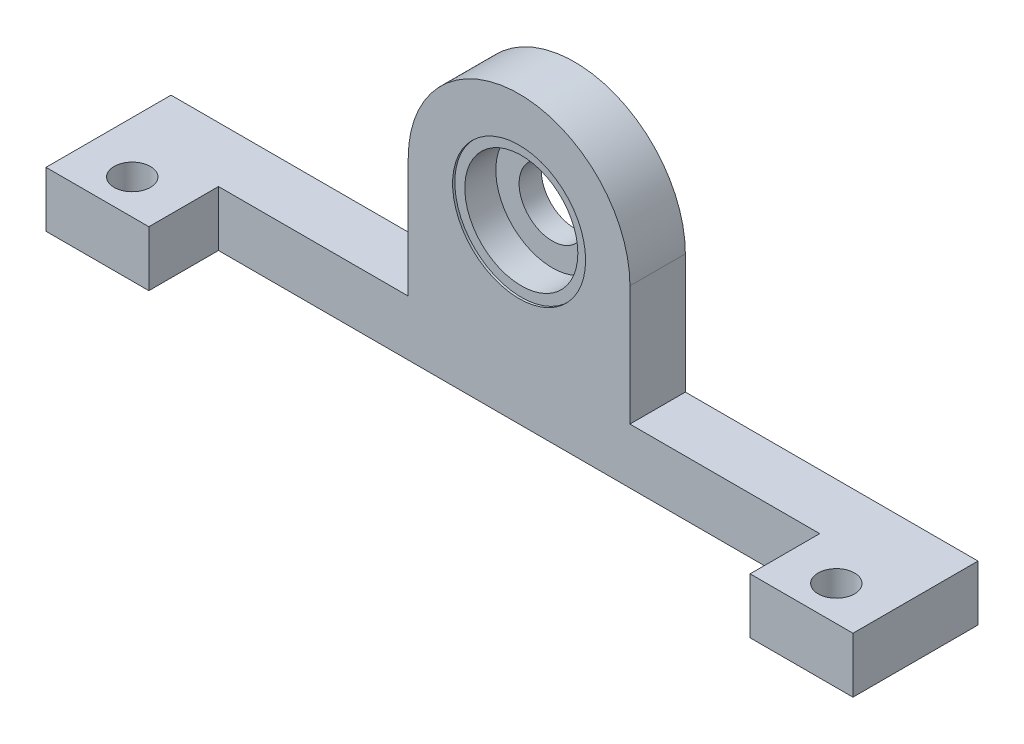
from build123d import *

# Parameters (mm, degrees)
SKETCH1_R           = 3.81
BOSS_EXTRUDE1_DEPTH = 3.175
SKETCH2_R           = 6.477
CUT_EXTRUDE1_DEPTH  = 3.81
SKETCH3_R           = 7.62
CUT_EXTRUDE2_DEPTH  = 0.254
SKETCH6_W           = 11.7856
SKETCH6_H           = 6.35
BOSS_EXTRUDE2_DEPTH = 7.9756
SKETCH7_R           = 2.0828
CUT_EXTRUDE4_DEPTH  = 55.398243725


with BuildPart() as part:
    # Sketch1 → Boss-Extrude1 (new, symmetric)
    with BuildSketch(Plane.XY):
        with BuildLine():
            Line((-12.7, 0), (-12.7, -13.716))
            Line((-12.7, -13.716), (-46.228, -13.716))
            Line((-46.228, -13.716), (-46.228, -20.066))
            Line((-46.228, -20.066), (46.228, -20.066))
            Line((46.228, -20.066), (46.228, -13.716))
            Line((46.228, -13.716), (12.7, -13.716))
            Line((12.7, -13.716), (12.7, 0))
            ThreePointArc((12.7, 0), (0, 12.7), (-12.7, 0))
        make_face()
        Circle(SKETCH1_R, mode=Mode.SUBTRACT)
    extrude(amount=BOSS_EXTRUDE1_DEPTH, both=True)

    # Sketch2 → Cut-Extrude1 (cut)
    with BuildSketch(Plane.XY.offset(3.175)):
        Circle(SKETCH2_R)
    extrude(amount=-CUT_EXTRUDE1_DEPTH, mode=Mode.SUBTRACT)

    # Sketch3 → Cut-Extrude2 (cut)
    with BuildSketch(Plane.XY.offset(3.175)):
        Circle(SKETCH3_R)
    extrude(amount=-CUT_EXTRUDE2_DEPTH, mode=Mode.SUBTRACT)

    # Sketch6 → Boss-Extrude2 (add)
    with BuildSketch(Plane.XY.offset(3.175)):
        with Locations((-40.3352, -16.891)):
            Rectangle(SKETCH6_W, SKETCH6_H)
    boss_extrude2 = extrude(amount=BOSS_EXTRUDE2_DEPTH)

    # Sketch7 → Cut-Extrude4 (cut, through all)
    with BuildSketch(Plane(origin=(0, -13.716, 0), x_dir=(1, 0, 0), z_dir=(0, 1, 0))):
        with Locations((-40.3352, -7.1628)):
            Circle(SKETCH7_R)
    cut_extrude4 = extrude(amount=-CUT_EXTRUDE4_DEPTH, mode=Mode.SUBTRACT)

    # Mirror2: Boss-Extrude2, Cut-Extrude4 across plane
    add(boss_extrude2.mirror(Plane(origin=(0, 0, 0), x_dir=(0, 0, 1), z_dir=(1, 0, 0))))
    add(cut_extrude4.mirror(Plane(origin=(0, 0, 0), x_dir=(0, 0, 1), z_dir=(1, 0, 0))), mode=Mode.SUBTRACT)


solid = part.part
